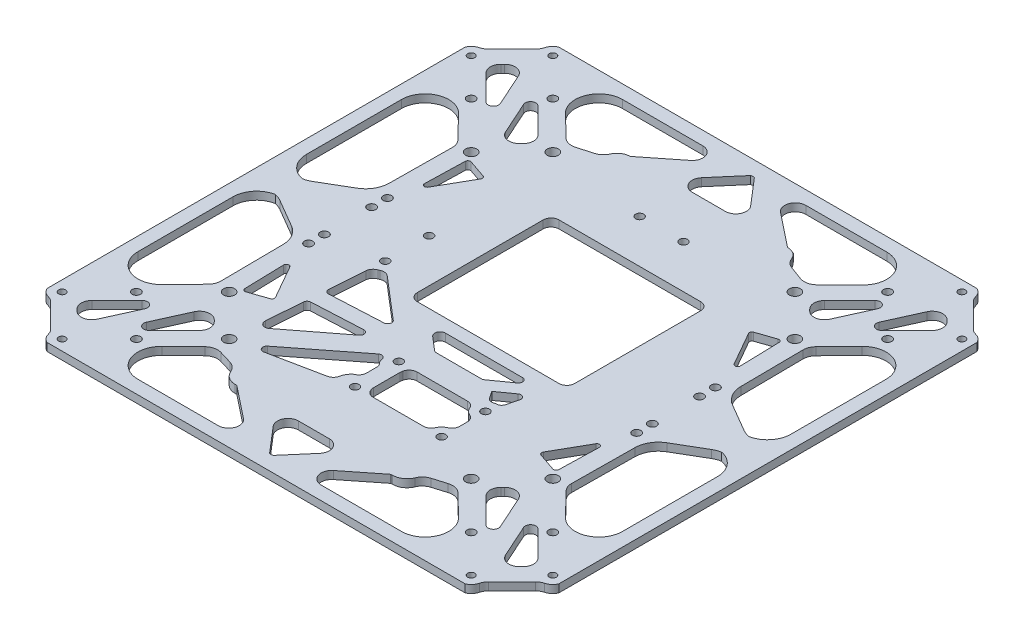
from build123d import *

# Parameters (mm, degrees)
SKETCH2_W                = 195
SKETCH2_H                = 195
BOSS_EXTRUDE1_DEPTH      = 3
CUT_EXTRUDE1_DEPTH       = 138.918454168
CUT_EXTRUDE1_DEPTH_BACK  = 138.918454168
SKETCH3_R                = 1.6
CUT_EXTRUDE2_DEPTH       = 138.918454168
CUT_EXTRUDE2_DEPTH_BACK  = 138.918454168
SKETCH4_R                = 2.11
SKETCH4_R_2              = 1.35
CUT_EXTRUDE3_DEPTH       = 138.918454168
CUT_EXTRUDE3_DEPTH_BACK  = 138.918454168
SKETCH5_R                = 2
CUT_EXTRUDE4_DEPTH       = 138.918454168
CUT_EXTRUDE4_DEPTH_BACK  = 138.918454168
SKETCH6_R                = 1.6
CUT_EXTRUDE5_DEPTH       = 138.918454168
CUT_EXTRUDE5_DEPTH_BACK  = 138.918454168
CUT_EXTRUDE7_DEPTH       = 138.918454168
CUT_EXTRUDE7_DEPTH_BACK  = 138.918454168
SKETCH8_R                = 3
SKETCH9_W                = 5.16198808
SKETCH9_H                = 152.468237428
BOSS_EXTRUDE2_DEPTH      = 3
FILLET1_R                = 9
BOSS_EXTRUDE3_DEPTH      = 3
FILLET2_R                = 9
FILLET3_R                = 4
BOSS_EXTRUDE4_DEPTH      = 3
SKETCH12_W               = 67.185291346
SKETCH12_H               = 7.329006054
SKETCH12_W_2             = 65.807604932
SKETCH12_H_2             = 7.680902366
BOSS_EXTRUDE5_DEPTH      = 3
CUT_EXTRUDE8_DEPTH       = 138.918454168
CUT_EXTRUDE8_DEPTH_BACK  = 138.918454168
SKETCH13_R               = 1.6
SKETCH14_W               = 7.084650063
SKETCH14_H               = 6.320619174
SKETCH14_W_2             = 7.244850247
SKETCH14_H_2             = 7.471829908
SKETCH14_H_3             = 7.337929735
SKETCH14_H_4             = 9.485616487
BOSS_EXTRUDE6_DEPTH      = 3
SKETCH15_W               = 76.15014778
SKETCH15_H               = 29.022259119
BOSS_EXTRUDE7_DEPTH      = 3
CUT_EXTRUDE9_DEPTH       = 138.918454168
CUT_EXTRUDE9_DEPTH_BACK  = 138.918454168
SKETCH16_W               = 60
SKETCH16_H               = 54
FILLET4_R                = 3
SKETCH17_R               = 1.55
CUT_EXTRUDE10_DEPTH      = 3
CUT_EXTRUDE11_DEPTH      = 138.918454168
CUT_EXTRUDE11_DEPTH_BACK = 138.918454168
SKETCH18_R               = 1.6
CUT_EXTRUDE12_DEPTH      = 138.918454168
CUT_EXTRUDE12_DEPTH_BACK = 138.918454168


with BuildPart() as part:
    # Sketch2 → Boss-Extrude1 (new body)
    with BuildSketch(Plane(origin=(0, 0, 0), x_dir=(1, 0, 0), z_dir=(0, 1, 0))):
        Rectangle(SKETCH2_W, SKETCH2_H)
    extrude(amount=BOSS_EXTRUDE1_DEPTH)

    # Sketch3 → Cut-Extrude1 (cut, two sides: drawn at the far end of the back side and taken through both)
    with BuildSketch(Plane(origin=(0, 3, 0), x_dir=(1, 0, 0), z_dir=(0, 1, 0)).offset(-CUT_EXTRUDE1_DEPTH_BACK)):
        with Locations(Location((47.5, 41.25, 0), (0, 0, 270))):
            Circle(SKETCH3_R)
        with Locations(Location((47.5, -41.25, 0), (0, 0, 90))):
            Circle(SKETCH3_R)
        with Locations(Location((-47.5, -41.25, 0), (0, 0, 270))):
            Circle(SKETCH3_R)
        with Locations(Location((-47.5, 41.25, 0), (0, 0, 90))):
            Circle(SKETCH3_R)
    extrude(amount=CUT_EXTRUDE1_DEPTH + CUT_EXTRUDE1_DEPTH_BACK, mode=Mode.SUBTRACT)

    # Sketch4 → Cut-Extrude2 (cut, two sides: drawn at the far end of the back side and taken through both)
    with BuildSketch(Plane(origin=(0, 3, 0), x_dir=(1, 0, 0), z_dir=(0, 1, 0)).offset(-CUT_EXTRUDE2_DEPTH_BACK)):
        with Locations(Location((46.123845661, 61.680194847, 0), (0, 0, 90))):
            Circle(SKETCH4_R)
        with Locations(Location((-61.680194847, 46.123845661, 0), (0, 0, 90))):
            Circle(SKETCH4_R)
        with Locations(Location((-77.943650814, 93.5, 0), (0, 0, 270))):
            Circle(SKETCH4_R_2)
        with Locations(Location((-93.5, 77.943650814, 0), (0, 0, 90))):
            Circle(SKETCH4_R_2)
        with Locations(Location((-46.123845661, 61.680194847, 0), (0, 0, 270))):
            Circle(SKETCH4_R)
        with Locations(Location((93.5, 77.943650814, 0), (0, 0, 270))):
            Circle(SKETCH4_R_2)
        with Locations(Location((77.943650814, 93.5, 0), (0, 0, 90))):
            Circle(SKETCH4_R_2)
        with Locations(Location((61.680194847, 46.123845661, 0), (0, 0, 270))):
            Circle(SKETCH4_R)
        with Locations(Location((61.680194847, -46.123845661, 0), (0, 0, 90))):
            Circle(SKETCH4_R)
        with Locations(Location((77.943650814, -93.5, 0), (0, 0, 270))):
            Circle(SKETCH4_R_2)
        with Locations(Location((93.5, -77.943650814, 0), (0, 0, 90))):
            Circle(SKETCH4_R_2)
        with Locations(Location((-46.123845661, -61.680194847, 0), (0, 0, 90))):
            Circle(SKETCH4_R)
        with Locations(Location((-93.5, -77.943650814, 0), (0, 0, 270))):
            Circle(SKETCH4_R_2)
        with Locations(Location((-77.943650814, -93.5, 0), (0, 0, 90))):
            Circle(SKETCH4_R_2)
        with Locations(Location((-61.680194847, -46.123845661, 0), (0, 0, 270))):
            Circle(SKETCH4_R)
        with Locations(Location((46.123845661, -61.680194847, 0), (0, 0, 270))):
            Circle(SKETCH4_R)
    extrude(amount=CUT_EXTRUDE2_DEPTH + CUT_EXTRUDE2_DEPTH_BACK, mode=Mode.SUBTRACT)

    # Sketch5 → Cut-Extrude3 (cut, two sides: drawn at the far end of the back side and taken through both)
    with BuildSketch(Plane(origin=(0, 3, 0), x_dir=(1, 0, 0), z_dir=(0, 1, 0)).offset(-CUT_EXTRUDE3_DEPTH_BACK)):
        with Locations(Location((30, 70, 0), (0, 0, 270))):
            Circle(SKETCH5_R)
        with Locations(Location((15, 70, 0), (0, 0, 270))):
            Circle(SKETCH5_R)
        with Locations(Location((-15, 70, 0), (0, 0, 90))):
            Circle(SKETCH5_R)
        with Locations(Location((-30, 70, 0), (0, 0, 90))):
            Circle(SKETCH5_R)
        with Locations(Location((-30, -70, 0), (0, 0, 270))):
            Circle(SKETCH5_R)
        with Locations(Location((-15, -70, 0), (0, 0, 270))):
            Circle(SKETCH5_R)
        with Locations(Location((15, -70, 0), (0, 0, 90))):
            Circle(SKETCH5_R)
        with Locations(Location((30, -70, 0), (0, 0, 90))):
            Circle(SKETCH5_R)
    extrude(amount=CUT_EXTRUDE3_DEPTH + CUT_EXTRUDE3_DEPTH_BACK, mode=Mode.SUBTRACT)

    # Sketch6 → Cut-Extrude4 (cut, two sides: drawn at the far end of the back side and taken through both)
    with BuildSketch(Plane(origin=(0, 3, 0), x_dir=(1, 0, 0), z_dir=(0, 1, 0)).offset(-CUT_EXTRUDE4_DEPTH_BACK)):
        with Locations(Location((-62.5, 15, 0), (0, 0, 270))):
            Circle(SKETCH6_R)
        with Locations(Location((-62.5, -15, 0), (0, 0, 90))):
            Circle(SKETCH6_R)
        with Locations(Location((62.5, -15, 0), (0, 0, 270))):
            Circle(SKETCH6_R)
        with Locations(Location((62.5, 15, 0), (0, 0, 90))):
            Circle(SKETCH6_R)
    extrude(amount=CUT_EXTRUDE4_DEPTH + CUT_EXTRUDE4_DEPTH_BACK, mode=Mode.SUBTRACT)

    # Sketch7 → Cut-Extrude5 (cut, two sides: drawn at the far end of the back side and taken through both)
    with BuildSketch(Plane(origin=(0, 3, 0), x_dir=(1, 0, 0), z_dir=(0, 1, 0)).offset(-CUT_EXTRUDE5_DEPTH_BACK)):
        with BuildLine():
            Line((-67.1, -15), (-67.099088544, 15.091567253))
            Line((-67.099088544, 15.091567253), (-66.810690491, 44.064798997))
            ThreePointArc((-66.810690491, 44.064798997), (-67.168435752, 45.972460378), (-68.225667159, 47.60016286))
            Line((-68.225667159, 47.60016286), (-92.33801192, 72.39859956))
            ThreePointArc((-92.33801192, 72.39859956), (-93.391805503, 73.22509409), (-94.627179243, 73.742226418))
            ThreePointArc((-94.627179243, 73.742226418), (-96.350328674, 74.657600533), (-97.5, 76.234118714))
            Line((-97.5, 76.234118714), (-97.5, -76.234118714))
            ThreePointArc((-97.5, -76.234118714), (-96.350328674, -74.657600533), (-94.627179243, -73.742226418))
            ThreePointArc((-94.627179243, -73.742226418), (-93.391805503, -73.22509409), (-92.33801192, -72.39859956))
            Line((-92.33801192, -72.39859956), (-68.225667159, -47.60016286))
            ThreePointArc((-68.225667159, -47.60016286), (-67.168435752, -45.972460378), (-66.810690491, -44.064798997))
            Line((-66.810690491, -44.064798997), (-67.099088544, -15.091567253))
            ThreePointArc((-67.099088544, -15.091567253), (-67.09977213, -15.045785894), (-67.1, -15))
        make_face()
        with BuildLine():
            ThreePointArc((-97.5, 79.653182914), (-96.342305944, 81.236642906), (-94.606672429, 82.150523302))
            ThreePointArc((-94.606672429, 82.150523302), (-93.388598506, 82.650187636), (-92.343175799, 83.450475015))
            Line((-92.343175799, 83.450475015), (-83.450475015, 92.343175799))
            ThreePointArc((-83.450475015, 92.343175799), (-82.650187636, 93.388598506), (-82.150523302, 94.606672429))
            ThreePointArc((-82.150523302, 94.606672429), (-81.236642906, 96.342305944), (-79.653182914, 97.5))
            Line((-79.653182914, 97.5), (-97.5, 97.5))
            Line((-97.5, 97.5), (-97.5, 79.653182914))
        make_face()
        with BuildLine():
            ThreePointArc((-94.606672429, -82.150523302), (-96.342305944, -81.236642906), (-97.5, -79.653182914))
            Line((-97.5, -79.653182914), (-97.5, -97.5))
            Line((-97.5, -97.5), (-79.653182914, -97.5))
            ThreePointArc((-79.653182914, -97.5), (-81.236642906, -96.342305944), (-82.150523302, -94.606672429))
            ThreePointArc((-82.150523302, -94.606672429), (-82.650187636, -93.388598506), (-83.450475015, -92.343175799))
            Line((-83.450475015, -92.343175799), (-92.343175799, -83.450475015))
            ThreePointArc((-92.343175799, -83.450475015), (-93.388598506, -82.650187636), (-94.606672429, -82.150523302))
        make_face()
        with BuildLine():
            Line((76.234118714, 97.5), (-76.234118714, 97.5))
            ThreePointArc((-76.234118714, 97.5), (-74.657600533, 96.350328674), (-73.742226418, 94.627179243))
            ThreePointArc((-73.742226418, 94.627179243), (-73.22509409, 93.391805503), (-72.39859956, 92.33801192))
            Line((-72.39859956, 92.33801192), (-48.235759925, 68.843679325))
            ThreePointArc((-48.235759925, 68.843679325), (-45.974176774, 67.580590379), (-43.384060973, 67.618697772))
            Line((-43.384060973, 67.618697772), (-37.791679223, 69.207086879))
            ThreePointArc((-37.791679223, 69.207086879), (-35.871810562, 70.248237651), (-34.578890795, 72.008422039))
            ThreePointArc((-34.578890795, 72.008422039), (-32.734765968, 74.185815942), (-30, 75))
            Line((-30, 75), (30, 75))
            ThreePointArc((30, 75), (32.793489967, 74.146855894), (34.633680134, 71.878565521))
            ThreePointArc((34.633680134, 71.878565521), (35.789643426, 70.16471047), (37.540094628, 69.064951015))
            Line((37.540094628, 69.064951015), (42.799329414, 67.128943555))
            ThreePointArc((42.799329414, 67.128943555), (45.584611872, 66.93434546), (48.039976467, 68.263575121))
            Line((48.039976467, 68.263575121), (72.419857752, 92.340779607))
            ThreePointArc((72.419857752, 92.340779607), (73.231780338, 93.389992898), (73.739189962, 94.615799689))
            ThreePointArc((73.739189962, 94.615799689), (74.653744886, 96.345877542), (76.234118714, 97.5))
        make_face()
        with BuildLine():
            ThreePointArc((-73.742226418, -94.627179243), (-74.657600533, -96.350328674), (-76.234118714, -97.5))
            Line((-76.234118714, -97.5), (76.234118714, -97.5))
            ThreePointArc((76.234118714, -97.5), (74.657600533, -96.350328674), (73.742226418, -94.627179243))
            ThreePointArc((73.742226418, -94.627179243), (73.22509409, -93.391805503), (72.39859956, -92.33801192))
            Line((72.39859956, -92.33801192), (48.235759925, -68.843679325))
            ThreePointArc((48.235759925, -68.843679325), (45.933721874, -67.570555303), (43.304064218, -67.642141429))
            Line((43.304064218, -67.642141429), (38.28462916, -69.158674052))
            ThreePointArc((38.28462916, -69.158674052), (36.361057884, -70.251030176), (35.097048147, -72.066422073))
            ThreePointArc((35.097048147, -72.066422073), (33.072838964, -74.561541483), (30, -75.5))
            Line((30, -75.5), (-30, -75.5))
            ThreePointArc((-30, -75.5), (-33.072838964, -74.561541483), (-35.097048147, -72.066422073))
            ThreePointArc((-35.097048147, -72.066422073), (-36.361057884, -70.251030176), (-38.28462916, -69.158674052))
            Line((-38.28462916, -69.158674052), (-43.304064218, -67.642141429))
            ThreePointArc((-43.304064218, -67.642141429), (-45.933721874, -67.570555303), (-48.235759925, -68.843679325))
            Line((-48.235759925, -68.843679325), (-72.39859956, -92.33801192))
            ThreePointArc((-72.39859956, -92.33801192), (-73.22509409, -93.391805503), (-73.742226418, -94.627179243))
        make_face()
        with BuildLine():
            Line((97.5, 97.5), (79.653182914, 97.5))
            ThreePointArc((79.653182914, 97.5), (81.236642906, 96.342305944), (82.150523302, 94.606672429))
            ThreePointArc((82.150523302, 94.606672429), (82.650187636, 93.388598506), (83.450475015, 92.343175799))
            Line((83.450475015, 92.343175799), (92.343175799, 83.450475015))
            ThreePointArc((92.343175799, 83.450475015), (93.388598506, 82.650187636), (94.606672429, 82.150523302))
            ThreePointArc((94.606672429, 82.150523302), (96.342305944, 81.236642906), (97.5, 79.653182914))
            Line((97.5, 79.653182914), (97.5, 97.5))
        make_face()
        with BuildLine():
            ThreePointArc((82.150523302, -94.606672429), (81.236642906, -96.342305944), (79.653182914, -97.5))
            Line((79.653182914, -97.5), (97.5, -97.5))
            Line((97.5, -97.5), (97.5, -79.653182914))
            ThreePointArc((97.5, -79.653182914), (96.342305944, -81.236642906), (94.606672429, -82.150523302))
            ThreePointArc((94.606672429, -82.150523302), (93.388598506, -82.650187636), (92.343175799, -83.450475015))
            Line((92.343175799, -83.450475015), (83.450475015, -92.343175799))
            ThreePointArc((83.450475015, -92.343175799), (82.650187636, -93.388598506), (82.150523302, -94.606672429))
        make_face()
        with BuildLine():
            ThreePointArc((94.627179243, -73.742226418), (96.350328674, -74.657600533), (97.5, -76.234118714))
            Line((97.5, -76.234118714), (97.5, 76.234118714))
            ThreePointArc((97.5, 76.234118714), (96.350328674, 74.657600533), (94.627179243, 73.742226418))
            ThreePointArc((94.627179243, 73.742226418), (93.391805503, 73.22509409), (92.33801192, 72.39859956))
            Line((92.33801192, 72.39859956), (68.225667159, 47.60016286))
            ThreePointArc((68.225667159, 47.60016286), (67.168435752, 45.972460378), (66.810690491, 44.064798997))
            Line((66.810690491, 44.064798997), (67.099088544, 15.091567253))
            ThreePointArc((67.099088544, 15.091567253), (67.09977213, 15.045785894), (67.1, 15))
            Line((67.1, 15), (67.099088544, -15.091567253))
            Line((67.099088544, -15.091567253), (66.810690491, -44.064798997))
            ThreePointArc((66.810690491, -44.064798997), (67.168435752, -45.972460378), (68.225667159, -47.60016286))
            Line((68.225667159, -47.60016286), (92.33801192, -72.39859956))
            ThreePointArc((92.33801192, -72.39859956), (93.391805503, -73.22509409), (94.627179243, -73.742226418))
        make_face()
    extrude(amount=CUT_EXTRUDE5_DEPTH + CUT_EXTRUDE5_DEPTH_BACK, mode=Mode.SUBTRACT)

    # Sketch8 → Cut-Extrude7 (cut, two sides: drawn at the far end of the back side and taken through both)
    with BuildSketch(Plane(origin=(0, 3, 0), x_dir=(1, 0, 0), z_dir=(0, 1, 0)).offset(-CUT_EXTRUDE7_DEPTH_BACK)):
        with Locations(Location((0, 0, 0), (0, 0, 270))):
            Circle(SKETCH8_R)
        with BuildLine():
            Line((-46.075946512, -21.34896745), (-46.075946512, 21.363521254))
            ThreePointArc((-46.075946512, 21.363521254), (-46.860319172, 22.339996984), (-47.982956213, 21.784630983))
            Line((-47.982956213, 21.784630983), (-56.124255266, 4.249445458))
            ThreePointArc((-56.124255266, 4.249445458), (-57.054155987, 0.045094312), (-56.129928738, -4.160507655))
            Line((-56.129928738, -4.160507655), (-47.98352356, -21.768853033))
            ThreePointArc((-47.98352356, -21.768853033), (-46.860977965, -22.325588422), (-46.075946512, -21.34896745))
        make_face()
        with BuildLine():
            Line((56.124255266, 4.249445458), (47.982956213, 21.784630983))
            ThreePointArc((47.982956213, 21.784630983), (46.860319172, 22.339996984), (46.075946512, 21.363521254))
            Line((46.075946512, 21.363521254), (46.075946512, -21.34896745))
            ThreePointArc((46.075946512, -21.34896745), (46.860977965, -22.325588422), (47.98352356, -21.768853033))
            Line((47.98352356, -21.768853033), (56.129928738, -4.160507655))
            ThreePointArc((56.129928738, -4.160507655), (57.054155987, 0.045094312), (56.124255266, 4.249445458))
        make_face()
        with BuildLine():
            Line((-58.318731361, 26.348348992), (-51.034926184, 39.095008052))
            ThreePointArc((-51.034926184, 39.095008052), (-50.967376772, 39.943698114), (-51.578125125, 40.536845815))
            Line((-51.578125125, 40.536845815), (-58.463843567, 42.903521965))
            ThreePointArc((-58.463843567, 42.903521965), (-59.359048857, 42.779356057), (-59.788541049, 41.984154106))
            Line((-59.788541049, 41.984154106), (-60.186627783, 26.870818896))
            ThreePointArc((-60.186627783, 26.870818896), (-59.456345727, 25.881451512), (-58.318731361, 26.348348992))
        make_face()
        with BuildLine():
            Line((-59.788541049, -41.984154106), (-60.186627783, -26.870818896))
            ThreePointArc((-60.186627783, -26.870818896), (-59.456345727, -25.881451512), (-58.318731361, -26.348348992))
            Line((-58.318731361, -26.348348992), (-51.034926184, -39.095008052))
            ThreePointArc((-51.034926184, -39.095008052), (-50.967376772, -39.943698114), (-51.578125125, -40.536845815))
            Line((-51.578125125, -40.536845815), (-58.463843567, -42.903521965))
            ThreePointArc((-58.463843567, -42.903521965), (-59.359048857, -42.779356057), (-59.788541049, -41.984154106))
        make_face()
        with BuildLine():
            Line((59.788541049, 41.984154106), (60.186627783, 26.870818896))
            ThreePointArc((60.186627783, 26.870818896), (59.456345727, 25.881451512), (58.318731361, 26.348348992))
            Line((58.318731361, 26.348348992), (51.034926184, 39.095008052))
            ThreePointArc((51.034926184, 39.095008052), (50.967376772, 39.943698114), (51.578125125, 40.536845815))
            Line((51.578125125, 40.536845815), (58.463843567, 42.903521965))
            ThreePointArc((58.463843567, 42.903521965), (59.359048857, 42.779356057), (59.788541049, 41.984154106))
        make_face()
        with BuildLine():
            Line((58.318731361, -26.348348992), (51.034926184, -39.095008052))
            ThreePointArc((51.034926184, -39.095008052), (50.967376772, -39.943698114), (51.578125125, -40.536845815))
            Line((51.578125125, -40.536845815), (58.463843567, -42.903521965))
            ThreePointArc((58.463843567, -42.903521965), (59.359048857, -42.779356057), (59.788541049, -41.984154106))
            Line((59.788541049, -41.984154106), (60.186627783, -26.870818896))
            ThreePointArc((60.186627783, -26.870818896), (59.456345727, -25.881451512), (58.318731361, -26.348348992))
        make_face()
        with BuildLine():
            Line((-29.190874416, -41.25), (-22, -41.25))
            ThreePointArc((-22, -41.25), (-17.050252532, -43.300252532), (-15, -48.25))
            Line((-15, -48.25), (-15, -58))
            ThreePointArc((-15, -58), (-17.050252532, -62.949747468), (-22, -65))
            Line((-22, -65), (-23.256091807, -65))
            ThreePointArc((-23.256091807, -65), (-26.685566957, -64.102352022), (-29.235481697, -61.639628628))
            Line((-29.235481697, -61.639628628), (-35.170264305, -51.889628628))
            ThreePointArc((-35.170264305, -51.889628628), (-35.293226438, -44.82052485), (-29.190874416, -41.25))
        make_face()
        with BuildLine():
            Line((29.190874416, 41.25), (22, 41.25))
            ThreePointArc((22, 41.25), (17.050252532, 43.300252532), (15, 48.25))
            Line((15, 48.25), (15, 58))
            ThreePointArc((15, 58), (17.050252532, 62.949747468), (22, 65))
            Line((22, 65), (23.256091807, 65))
            ThreePointArc((23.256091807, 65), (26.685566957, 64.102352022), (29.235481697, 61.639628628))
            Line((29.235481697, 61.639628628), (35.170264305, 51.889628628))
            ThreePointArc((35.170264305, 51.889628628), (35.293226438, 44.82052485), (29.190874416, 41.25))
        make_face()
        with BuildLine():
            Line((29.235481697, -61.639628628), (35.170264305, -51.889628628))
            ThreePointArc((35.170264305, -51.889628628), (35.293226438, -44.82052485), (29.190874416, -41.25))
            Line((29.190874416, -41.25), (22, -41.25))
            ThreePointArc((22, -41.25), (17.050252532, -43.300252532), (15, -48.25))
            Line((15, -48.25), (15, -58))
            ThreePointArc((15, -58), (17.050252532, -62.949747468), (22, -65))
            Line((22, -65), (23.256091807, -65))
            ThreePointArc((23.256091807, -65), (26.685566957, -64.102352022), (29.235481697, -61.639628628))
        make_face()
        with BuildLine():
            Line((-29.235481697, 61.639628628), (-35.170264305, 51.889628628))
            ThreePointArc((-35.170264305, 51.889628628), (-35.293226438, 44.82052485), (-29.190874416, 41.25))
            Line((-29.190874416, 41.25), (-22, 41.25))
            ThreePointArc((-22, 41.25), (-17.050252532, 43.300252532), (-15, 48.25))
            Line((-15, 48.25), (-15, 58))
            ThreePointArc((-15, 58), (-17.050252532, 62.949747468), (-22, 65))
            Line((-22, 65), (-23.256091807, 65))
            ThreePointArc((-23.256091807, 65), (-26.685566957, 64.102352022), (-29.235481697, 61.639628628))
        make_face()
        with BuildLine():
            Line((-55.317751874, 58.143142882), (-54.609127035, 58.851767722))
            ThreePointArc((-54.609127035, 58.851767722), (-53.437554159, 61.680194847), (-54.609127035, 64.508621971))
            Line((-54.609127035, 64.508621971), (-64.215657306, 74.115152242))
            ThreePointArc((-64.215657306, 74.115152242), (-66.766627573, 74.346473303), (-67.453044382, 71.878723174))
            Line((-67.453044382, 71.878723174), (-61.792526027, 59.327138995))
            ThreePointArc((-61.792526027, 59.327138995), (-58.865699631, 57.036815878), (-55.317751874, 58.143142882))
        make_face()
        with BuildLine():
            Line((-84.306093786, 81.480702778), (-85.014718626, 80.772077939))
            ThreePointArc((-85.014718626, 80.772077939), (-86.186291501, 77.943650814), (-85.014718626, 75.115223689))
            Line((-85.014718626, 75.115223689), (-75.408188355, 65.508693418))
            ThreePointArc((-75.408188355, 65.508693418), (-72.857218088, 65.277372358), (-72.170801279, 67.745122487))
            Line((-72.170801279, 67.745122487), (-77.831319634, 80.296706666))
            ThreePointArc((-77.831319634, 80.296706666), (-80.758146029, 82.587029783), (-84.306093786, 81.480702778))
        make_face()
        with BuildLine():
            Line((55.317751874, -58.143142882), (54.609127035, -58.851767722))
            ThreePointArc((54.609127035, -58.851767722), (53.437554159, -61.680194847), (54.609127035, -64.508621971))
            Line((54.609127035, -64.508621971), (64.215657306, -74.115152242))
            ThreePointArc((64.215657306, -74.115152242), (66.766627573, -74.346473303), (67.453044382, -71.878723174))
            Line((67.453044382, -71.878723174), (61.792526027, -59.327138995))
            ThreePointArc((61.792526027, -59.327138995), (58.865699631, -57.036815878), (55.317751874, -58.143142882))
        make_face()
        with BuildLine():
            Line((-32.5, -18.207707646), (-14.5051535, -3.060146984))
            ThreePointArc((-14.5051535, -3.060146984), (-13.081100012, 0), (-14.5051535, 3.060146984))
            Line((-14.5051535, 3.060146984), (-32.5, 18.207707646))
            ThreePointArc((-32.5, 18.207707646), (-36.763580055, 18.774114539), (-39.075946512, 15.147560662))
            Line((-39.075946512, 15.147560662), (-39.075946512, -15.147560662))
            ThreePointArc((-39.075946512, -15.147560662), (-36.763580055, -18.774114539), (-32.5, -18.207707646))
        make_face()
        with BuildLine():
            Line((67.453044382, 71.878723174), (61.792526027, 59.327138995))
            ThreePointArc((61.792526027, 59.327138995), (58.865699631, 57.036815878), (55.317751874, 58.143142882))
            Line((55.317751874, 58.143142882), (54.609127035, 58.851767722))
            ThreePointArc((54.609127035, 58.851767722), (53.437554159, 61.680194847), (54.609127035, 64.508621971))
            Line((54.609127035, 64.508621971), (64.215657306, 74.115152242))
            ThreePointArc((64.215657306, 74.115152242), (66.766627573, 74.346473303), (67.453044382, 71.878723174))
        make_face()
        with BuildLine():
            Line((77.831319634, 80.296706666), (72.170801279, 67.745122487))
            ThreePointArc((72.170801279, 67.745122487), (72.857218088, 65.277372358), (75.408188355, 65.508693418))
            Line((75.408188355, 65.508693418), (85.014718626, 75.115223689))
            ThreePointArc((85.014718626, 75.115223689), (86.186291501, 77.943650814), (85.014718626, 80.772077939))
            Line((85.014718626, 80.772077939), (84.306093786, 81.480702778))
            ThreePointArc((84.306093786, 81.480702778), (80.758146029, 82.587029783), (77.831319634, 80.296706666))
        make_face()
        with BuildLine():
            Line((84.306093786, -81.480702778), (85.014718626, -80.772077939))
            ThreePointArc((85.014718626, -80.772077939), (86.186291501, -77.943650814), (85.014718626, -75.115223689))
            Line((85.014718626, -75.115223689), (75.408188355, -65.508693418))
            ThreePointArc((75.408188355, -65.508693418), (72.857218088, -65.277372358), (72.170801279, -67.745122487))
            Line((72.170801279, -67.745122487), (77.831319634, -80.296706666))
            ThreePointArc((77.831319634, -80.296706666), (80.758146029, -82.587029783), (84.306093786, -81.480702778))
        make_face()
        with BuildLine():
            Line((-67.453044382, -71.878723174), (-61.792526027, -59.327138995))
            ThreePointArc((-61.792526027, -59.327138995), (-58.865699631, -57.036815878), (-55.317751874, -58.143142882))
            Line((-55.317751874, -58.143142882), (-54.609127035, -58.851767722))
            ThreePointArc((-54.609127035, -58.851767722), (-53.437554159, -61.680194847), (-54.609127035, -64.508621971))
            Line((-54.609127035, -64.508621971), (-64.215657306, -74.115152242))
            ThreePointArc((-64.215657306, -74.115152242), (-66.766627573, -74.346473303), (-67.453044382, -71.878723174))
        make_face()
        with BuildLine():
            Line((-77.831319634, -80.296706666), (-72.170801279, -67.745122487))
            ThreePointArc((-72.170801279, -67.745122487), (-72.857218088, -65.277372358), (-75.408188355, -65.508693418))
            Line((-75.408188355, -65.508693418), (-85.014718626, -75.115223689))
            ThreePointArc((-85.014718626, -75.115223689), (-86.186291501, -77.943650814), (-85.014718626, -80.772077939))
            Line((-85.014718626, -80.772077939), (-84.306093786, -81.480702778))
            ThreePointArc((-84.306093786, -81.480702778), (-80.758146029, -82.587029783), (-77.831319634, -80.296706666))
        make_face()
        with BuildLine():
            Line((-20.31441961, 26.25), (-2.575946512, 11.318247329))
            ThreePointArc((-2.575946512, 11.318247329), (0, 10.378394314), (2.575946512, 11.318247329))
            Line((2.575946512, 11.318247329), (20.31441961, 26.25))
            ThreePointArc((20.31441961, 26.25), (21.496171059, 30.681170701), (17.738473098, 33.310146984))
            Line((17.738473098, 33.310146984), (-17.738473098, 33.310146984))
            ThreePointArc((-17.738473098, 33.310146984), (-21.496171059, 30.681170701), (-20.31441961, 26.25))
        make_face()
        with BuildLine():
            Line((32.5, -18.207707646), (14.5051535, -3.060146984))
            ThreePointArc((14.5051535, -3.060146984), (13.081100012, 0), (14.5051535, 3.060146984))
            Line((14.5051535, 3.060146984), (32.5, 18.207707646))
            ThreePointArc((32.5, 18.207707646), (36.763580055, 18.774114539), (39.075946512, 15.147560662))
            Line((39.075946512, 15.147560662), (39.075946512, -15.147560662))
            ThreePointArc((39.075946512, -15.147560662), (36.763580055, -18.774114539), (32.5, -18.207707646))
        make_face()
        with BuildLine():
            Line((17.738473098, -33.310146984), (-17.738473098, -33.310146984))
            ThreePointArc((-17.738473098, -33.310146984), (-21.496171059, -30.681170701), (-20.31441961, -26.25))
            Line((-20.31441961, -26.25), (-2.575946512, -11.318247329))
            ThreePointArc((-2.575946512, -11.318247329), (0, -10.378394314), (2.575946512, -11.318247329))
            Line((2.575946512, -11.318247329), (20.31441961, -26.25))
            ThreePointArc((20.31441961, -26.25), (21.496171059, -30.681170701), (17.738473098, -33.310146984))
        make_face()
    extrude(amount=CUT_EXTRUDE7_DEPTH + CUT_EXTRUDE7_DEPTH_BACK, mode=Mode.SUBTRACT)

    # Sketch9 → Boss-Extrude2 (add)
    with BuildSketch(Plane(origin=(0, 0, 0), x_dir=(1, 0, 0), z_dir=(0, 1, 0))):
        Polygon((-76.234118714, 97.5), (76.234118714, 97.5), (75.78009356, 92.33801192), (-72.39859956, 92.33801192), (-74.953859457, 93.391805503), align=None)
        with Locations((-94.91900596, 0)):
            Rectangle(SKETCH9_W, SKETCH9_H)
        with Locations((94.91900596, 0)):
            Rectangle(SKETCH9_W, SKETCH9_H)
        Polygon((-74.953859457, -93.391805503), (-72.39859956, -92.33801192), (72.39859956, -92.33801192), (75.78009356, -93.391805503), (76.234118714, -97.5), (-76.234118714, -97.5), align=None)
    extrude(amount=BOSS_EXTRUDE2_DEPTH)

    # Fillet1
    fillet1_edges = [part.edges().sort_by_distance(p)[0] for p in [
        (72.417055273, 1.5, -92.33801192),
        (92.33801192, 1.5, -72.39859956),
        (-72.39859956, 1.5, -92.33801192),
        (-92.33801192, 1.5, -72.39859956),
        (-92.33801192, 1.5, 72.39859956),
        (-72.39859956, 1.5, 92.33801192),
        (72.39859956, 1.5, 92.33801192),
        (92.33801192, 1.5, 72.39859956),
    ]]
    fillet(fillet1_edges, radius=FILLET1_R)

    # Sketch10 → Boss-Extrude3 (add)
    with BuildSketch(Plane.XZ):
        Polygon((15, -75), (0.131749864, -92.33801192), (8.131749864, -92.33801192), (30, -75), align=None)
        Polygon((-30, -75), (-8.131749864, -92.33801192), (-0.131749864, -92.33801192), (-15, -75), align=None)
        Polygon((-15, 75), (-0.131749864, 92.33801192), (-8.131749864, 92.33801192), (-30, 75), align=None)
        Polygon((30, 75), (8.131749864, 92.33801192), (0.131749864, 92.33801192), (15, 75), align=None)
        Polygon((-92.33801192, 5), (-92.33801192, -5), (-84.33801192, -5), (-67.099088544, -15.091567253), (-67.099088544, 15.091567253), (-84.33801192, 5), align=None)
        Polygon((92.33801192, -5), (92.33801192, 5), (84.33801192, 5), (67.099088544, 15.091567253), (67.099088544, -15.091567253), (84.33801192, -5), align=None)
    extrude(amount=-BOSS_EXTRUDE3_DEPTH)

    # Fillet2
    # the kernel refuses this fillet: 9 mm, written as the material it adds along each edge
    with BuildSketch(Plane(origin=(84.33801192, 0, 5), x_dir=(-0.8630037712429959, 0, 0.5051974770526539), z_dir=(0, 1, 0)), Plane(origin=(-84.33801192, 0, -5), x_dir=(0.8630037712431919, 0, -0.5051974770523192), z_dir=(0, 1, 0))) as fillet2_piece_1:
        with BuildLine():
            CenterArc((FILLET2_R * 0.271173620178, FILLET2_R), FILLET2_R, 239.655537794, 30.344462206)
            Line((-FILLET2_R * 0.234023856875, FILLET2_R * 0.136996228757), (0, 0))
            Line((0, 0), (FILLET2_R * 0.271173620178, 0))
        make_face()
    extrude(amount=3)
    with BuildSketch(Plane(origin=(92.33801192, 0, 5), x_dir=(0, 0, 1), z_dir=(0, 1, 0)), Plane(origin=(-92.33801192, 0, -5), x_dir=(0, 0, -1), z_dir=(0, 1, 0))) as fillet2_piece_2:
        with BuildLine():
            CenterArc((FILLET2_R, -FILLET2_R), FILLET2_R, 90, 90)
            Line((0, -FILLET2_R), (0, 0))
            Line((0, 0), (FILLET2_R, 0))
        make_face()
    extrude(amount=3)
    with BuildSketch(Plane(origin=(67.099088544, 0, 15.091567253), x_dir=(-0.009953455302394536, 0, 0.9999504631368212), z_dir=(0, 1, 0)), Plane(origin=(67.099088544, 3, -15.091567253), x_dir=(-0.00995345530239279, 0, -0.9999504631368212), z_dir=(0, -1, 0)), Plane(origin=(-67.099088544, 0, -15.091567253), x_dir=(0.009953455302046058, 0, -0.9999504631368247), z_dir=(0, 1, 0))) as fillet2_piece_3:
        with BuildLine():
            CenterArc((FILLET2_R * 0.566755129621, FILLET2_R), FILLET2_R, 210.914762604, 59.085237396)
            Line((-FILLET2_R * 0.291177430616, FILLET2_R * 0.486237679383), (0, 0))
            Line((0, 0), (FILLET2_R * 0.566755129621, 0))
        make_face()
    extrude(amount=3)
    with BuildSketch(Plane(origin=(84.33801192, 0, -5), x_dir=(-0.8630037712431919, 0, -0.5051974770523192), z_dir=(0, 1, 0)), Plane(origin=(-84.33801192, 0, 5), x_dir=(0.8630037712429962, 0, 0.5051974770526534), z_dir=(0, 1, 0))) as fillet2_piece_4:
        with BuildLine():
            CenterArc((FILLET2_R * 0.271173620177, -FILLET2_R), FILLET2_R, 90, 30.344462206)
            Line((-FILLET2_R * 0.234023856875, -FILLET2_R * 0.136996228757), (0, 0))
            Line((0, 0), (FILLET2_R * 0.271173620177, 0))
        make_face()
    extrude(amount=3)
    with BuildSketch(Plane(origin=(92.33801192, 0, -5), x_dir=(0, 0, -1), z_dir=(0, 1, 0)), Plane(origin=(-92.33801192, 0, 5), x_dir=(0, 0, 1), z_dir=(0, 1, 0))) as fillet2_piece_5:
        with BuildLine():
            CenterArc((FILLET2_R, FILLET2_R), FILLET2_R, 180, 90)
            Line((0, FILLET2_R), (0, 0))
            Line((0, 0), (FILLET2_R, 0))
        make_face()
    extrude(amount=3)
    with BuildSketch(Plane(origin=(-67.099088544, 0, 15.091567253), x_dir=(0.009953455302383283, 0, 0.9999504631368213), z_dir=(0, 1, 0))) as fillet2_piece_6:
        with BuildLine():
            CenterArc((FILLET2_R * 0.566755129621, -FILLET2_R), FILLET2_R, 90, 59.085237396)
            Line((-FILLET2_R * 0.291177430616, -FILLET2_R * 0.486237679383), (0, 0))
            Line((0, 0), (FILLET2_R * 0.566755129621, 0))
        make_face()
    extrude(amount=3)

    # Fillet3
    fillet3_edges = [part.edges().sort_by_distance(p)[0] for p in [
        (-14.571223904, 1.5, 75.5),
        (-8.131749864, 1.5, 92.33801192),
        (8.131749864, 1.5, 92.33801192),
        (14.571223904, 1.5, 75.5),
        (15, 1.5, -75),
        (8.131749864, 1.5, -92.33801192),
        (-8.131749864, 1.5, -92.33801192),
        (-15, 1.5, -75),
    ]]
    fillet(fillet3_edges, radius=FILLET3_R)

    # Sketch11 → Boss-Extrude4 (add)
    with BuildSketch(Plane.XZ):
        with BuildLine():
            Line((-1.502465546, 92.33801192), (1.497534454, 92.33801192))
            Line((1.497534454, 92.33801192), (1.497534454, 90.83801192))
            ThreePointArc((1.497534454, 90.83801192), (-0.002465546, 91.809351713), (-1.502465546, 90.83801192))
            Line((-1.502465546, 90.83801192), (-1.502465546, 92.33801192))
        make_face()
        with BuildLine():
            Line((-1.502465546, -92.33801192), (-1.502465546, -90.83801192))
            ThreePointArc((-1.502465546, -90.83801192), (-0.002465546, -91.809351713), (1.497534454, -90.83801192))
            Line((1.497534454, -90.83801192), (1.497534454, -92.33801192))
            Line((1.497534454, -92.33801192), (-1.502465546, -92.33801192))
        make_face()
    extrude(amount=-BOSS_EXTRUDE4_DEPTH)

    # Sketch12 → Boss-Extrude5 (add)
    with BuildSketch(Plane(origin=(0, 0, 0), x_dir=(1, 0, 0), z_dir=(0, 1, 0))):
        with Locations((-0.519806709, -68.837538491)):
            Rectangle(SKETCH12_W, SKETCH12_H)
        with Locations((0.169036498, 70.345364759)):
            Rectangle(SKETCH12_W_2, SKETCH12_H_2)
    extrude(amount=BOSS_EXTRUDE5_DEPTH)

    # Sketch13 → Cut-Extrude8 (cut, two sides: drawn at the far end of the back side and taken through both)
    with BuildSketch(Plane(origin=(0, 3, 0), x_dir=(1, 0, 0), z_dir=(0, 1, 0)).offset(-CUT_EXTRUDE8_DEPTH_BACK)):
        with Locations(Location((-62.5, 9, 0), (0, 0, 270))):
            Circle(SKETCH13_R)
        with Locations(Location((-62.5, -9, 0), (0, 0, 90))):
            Circle(SKETCH13_R)
        with Locations(Location((62.5, -9, 0), (0, 0, 270))):
            Circle(SKETCH13_R)
        with Locations(Location((62.5, 9, 0), (0, 0, 90))):
            Circle(SKETCH13_R)
    extrude(amount=CUT_EXTRUDE8_DEPTH + CUT_EXTRUDE8_DEPTH_BACK, mode=Mode.SUBTRACT)

    # Sketch14 → Boss-Extrude6 (add)
    with BuildSketch(Plane(origin=(0, 3, 0), x_dir=(1, 0, 0), z_dir=(0, 1, 0))):
        with Locations((-46.210776171, -41.637759037)):
            Rectangle(SKETCH14_W, SKETCH14_H)
        with Locations((46.847651561, -41.06215367)):
            Rectangle(SKETCH14_W_2, SKETCH14_H_2)
        with Locations((-46.210776171, 41.649000738)):
            Rectangle(SKETCH14_W, SKETCH14_H_3)
        with Locations((46.847651561, 40.575157362)):
            Rectangle(SKETCH14_W_2, SKETCH14_H_4)
    extrude(amount=-BOSS_EXTRUDE6_DEPTH)

    # Sketch15 → Boss-Extrude7 (add)
    with BuildSketch(Plane(origin=(0, 0, 0), x_dir=(1, 0, 0), z_dir=(0, 1, 0))):
        with Locations((0.036097087, -52.660909868)):
            Rectangle(SKETCH15_W, SKETCH15_H)
        Polygon((58.562577352, -23.055568165), (26.305881429, -23.055568165), (26.305881429, -35.895612173), (-27.246497238, -35.895612173), (-27.246497238, -23.055568165), (-57.937334136, -23.055568165), (-57.937334136, 24.546546207), (-27.246497238, 24.546546207), (-27.246497238, 38.012933825), (-41.652400272, 38.012933825), (-41.652400272, 66.511568087), (40.085440852, 66.511568087), (40.085440852, 38.012933825), (26.305881429, 38.012933825), (26.305881429, 24.546546207), (58.562577352, 24.546546207), align=None)
    extrude(amount=BOSS_EXTRUDE7_DEPTH)

    # Sketch16 → Cut-Extrude9 (cut, two sides: drawn at the far end of the back side and taken through both)
    with BuildSketch(Plane(origin=(0, 3, 0), x_dir=(1, 0, 0), z_dir=(0, 1, 0)).offset(-CUT_EXTRUDE9_DEPTH_BACK)):
        with Locations((4.4, 13.5)):
            Rectangle(SKETCH16_W, SKETCH16_H)
    extrude(amount=CUT_EXTRUDE9_DEPTH + CUT_EXTRUDE9_DEPTH_BACK, mode=Mode.SUBTRACT)

    # Fillet4
    fillet4_edges = [part.edges().sort_by_distance(p)[0] for p in [
        (34.4, 1.5, -40.5),
        (34.4, 1.5, 13.5),
        (-25.6, 1.5, 13.5),
        (-25.6, 1.5, -40.5),
    ]]
    fillet(fillet4_edges, radius=FILLET4_R)

    # Sketch17 → Cut-Extrude10 (cut)
    with BuildSketch(Plane(origin=(0, 3, 0), x_dir=(1, 0, 0), z_dir=(0, 1, 0))):
        with Locations(Location((-42.1, 10.5, 0), (0, 0, 270))):
            Circle(SKETCH17_R)
        with Locations(Location((-42.1, -6.21, 0), (0, 0, 270))):
            Circle(SKETCH17_R)
        with Locations(Location((-6.376154339, -36.746034728, 0), (0, 0, 270))):
            Circle(SKETCH17_R)
        with Locations(Location((-6.376154339, -53.456034728, 0), (0, 0, 270))):
            Circle(SKETCH17_R)
        with Locations(Location((26.623845661, -36.746034728, 0), (0, 0, 270))):
            Circle(SKETCH17_R)
        with Locations(Location((26.623845661, -53.456034728, 0), (0, 0, 270))):
            Circle(SKETCH17_R)
        with Locations(Location((8.354999866, 57.002112452, 0), (0, 0, 270))):
            Circle(SKETCH17_R)
        with Locations(Location((-8.355, 57, 0), (0, 0, 270))):
            Circle(SKETCH17_R)
    extrude(amount=-CUT_EXTRUDE10_DEPTH, mode=Mode.SUBTRACT)

    # Sketch18 → Cut-Extrude11 (cut, two sides: drawn at the far end of the back side and taken through both)
    with BuildSketch(Plane(origin=(0, 3, 0), x_dir=(1, 0, 0), z_dir=(0, 1, 0)).offset(-CUT_EXTRUDE11_DEPTH_BACK)):
        with Locations(Location((-63.80151519, 79.357864376, 0), (0, 0, 270))):
            Circle(SKETCH18_R)
        with Locations(Location((-79.357864376, 63.80151519, 0), (0, 0, 90))):
            Circle(SKETCH18_R)
        with Locations(Location((79.357864376, 63.80151519, 0), (0, 0, 270))):
            Circle(SKETCH18_R)
        with Locations(Location((63.80151519, 79.357864376, 0), (0, 0, 90))):
            Circle(SKETCH18_R)
        with Locations(Location((63.80151519, -79.357864376, 0), (0, 0, 270))):
            Circle(SKETCH18_R)
        with Locations(Location((79.357864376, -63.80151519, 0), (0, 0, 90))):
            Circle(SKETCH18_R)
        with Locations(Location((-79.357864376, -63.80151519, 0), (0, 0, 270))):
            Circle(SKETCH18_R)
        with Locations(Location((-63.80151519, -79.357864376, 0), (0, 0, 90))):
            Circle(SKETCH18_R)
    extrude(amount=CUT_EXTRUDE11_DEPTH + CUT_EXTRUDE11_DEPTH_BACK, mode=Mode.SUBTRACT)

    # Sketch20 → Cut-Extrude12 (cut, two sides: drawn at the far end of the back side and taken through both)
    with BuildSketch(Plane(origin=(0, 3, 0), x_dir=(1, 0, 0), z_dir=(0, 1, 0)).offset(-CUT_EXTRUDE12_DEPTH_BACK)):
        with BuildLine():
            ThreePointArc((22.47806898, -18.5), (23.90692636, -19.543528109), (23.347713288, -21.222177883))
            Line((23.347713288, -21.222177883), (15.584613359, -26.746034728))
            Line((15.584613359, -26.746034728), (0.55222931, -26.746034728))
            Line((0.55222931, -26.746034728), (-1.946364371, -26.746034728))
            ThreePointArc((-1.946364371, -26.746034728), (-2.638977793, -26.622277422), (-3.245875244, -26.266321375))
            Line((-3.245875244, -26.266321375), (-5.14516455, -24.642846547))
            Line((-5.14516455, -24.642846547), (-8.213274929, -22.020286648))
            ThreePointArc((-8.213274929, -22.020286648), (-8.79000675, -19.807386578), (-6.913764056, -18.5))
            Line((-6.913764056, -18.5), (22.47806898, -18.5))
        make_face()
        with BuildLine():
            ThreePointArc((-2.18241673, -51.689611249), (-2.21362049, -51.621648334), (-2.245726487, -51.554106957))
            ThreePointArc((-2.245726487, -51.554106957), (-2.469150497, -50.918040577), (-2.544900285, -50.248144543))
            Line((-2.544900285, -50.248144543), (-2.544900285, -40.193148575))
            ThreePointArc((-2.544900285, -40.193148575), (-2.522155863, -39.824435644), (-2.454267468, -39.461313489))
            ThreePointArc((-2.454267468, -39.461313489), (-2.42432336, -39.333524843), (-2.398549849, -39.20483019))
            ThreePointArc((-2.398549849, -39.20483019), (-1.36823761, -37.441298993), (0.55222931, -36.746034728))
            Line((0.55222931, -36.746034728), (19.695462011, -36.746034728))
            ThreePointArc((19.695462011, -36.746034728), (21.34225299, -37.238430399), (22.448462136, -38.553981748))
            ThreePointArc((22.448462136, -38.553981748), (23.406509806, -39.963370582), (24.815898641, -40.921418252))
            ThreePointArc((24.815898641, -40.921418252), (26.131449989, -42.027627398), (26.623845661, -43.674418378))
            Line((26.623845661, -43.674418378), (26.623845661, -46.527651078))
            ThreePointArc((26.623845661, -46.527651078), (26.131449989, -48.174442057), (24.815898641, -49.280651204))
            ThreePointArc((24.815898641, -49.280651204), (23.406509806, -50.238698873), (22.448462136, -51.648087708))
            ThreePointArc((22.448462136, -51.648087708), (21.34225299, -52.963639057), (19.695462011, -53.456034728))
            Line((19.695462011, -53.456034728), (0.55222931, -53.456034728))
            ThreePointArc((0.55222931, -53.456034728), (-1.075540703, -52.97602774), (-2.18241673, -51.689611249))
        make_face()
        with BuildLine():
            Line((21.185792417, -28.897085365), (23.07173769, -31.619142007))
            ThreePointArc((23.07173769, -31.619142007), (24.058846992, -32.369186673), (25.298349398, -32.393384999))
            ThreePointArc((25.298349398, -32.393384999), (25.831914193, -32.265482915), (26.376995047, -32.202735841))
            ThreePointArc((26.376995047, -32.202735841), (27.533104301, -31.755116397), (28.203300481, -30.71214523))
            Line((28.203300481, -30.71214523), (29.346879546, -26.343403803))
            ThreePointArc((29.346879546, -26.343403803), (28.7479136, -24.729111414), (27.026126839, -24.741378037))
            Line((27.026126839, -24.741378037), (21.185792417, -28.897085365))
        make_face()
        with BuildLine():
            ThreePointArc((-12.758368613, -38.172321464), (-11.286659447, -37.958233637), (-10.353955874, -39.11660556))
            ThreePointArc((-10.353955874, -39.11660556), (-9.937831989, -40.36163732), (-9.144185854, -41.407289741))
            ThreePointArc((-9.144185854, -41.407289741), (-8.824850818, -42.150635277), (-8.715761243, -42.952281656))
            Line((-8.715761243, -42.952281656), (-8.715761243, -46.692915256))
            ThreePointArc((-8.715761243, -46.692915256), (-9.251897049, -48.404456443), (-10.668676733, -49.504251954))
            ThreePointArc((-10.668676733, -49.504251954), (-11.989109973, -50.905987269), (-12.758368613, -52.671390051))
            ThreePointArc((-12.758368613, -52.671390051), (-13.529128179, -54.352887616), (-15.139653501, -55.262674711))
            Line((-15.139653501, -55.262674711), (-35.263821397, -59.359186552))
            ThreePointArc((-35.263821397, -59.359186552), (-36.925238113, -58.517330308), (-36.486412703, -56.707230946))
            Line((-36.486412703, -56.707230946), (-12.758368613, -38.172321464))
        make_face()
        with BuildLine():
            Line((-23.594859048, -32.950311344), (-42.790690579, -33.921202103))
            ThreePointArc((-42.790690579, -33.921202103), (-43.763914131, -34.347087753), (-44.210989017, -35.310761304))
            Line((-44.210989017, -35.310761304), (-45.191419201, -48.826352586))
            ThreePointArc((-45.191419201, -48.826352586), (-44.144054264, -50.732429718), (-41.976371931, -50.555634233))
            Line((-41.976371931, -50.555634233), (-22.603872033, -35.636831781))
            ThreePointArc((-22.603872033, -35.636831781), (-22.111780716, -33.929277391), (-23.594859048, -32.950311344))
        make_face()
        with BuildLine():
            Line((-43.554881118, -26.266072197), (-42.601272507, -13.120226181))
            ThreePointArc((-42.601272507, -13.120226181), (-41.991021009, -11.513376115), (-40.598882511, -10.505246941))
            ThreePointArc((-40.598882511, -10.505246941), (-40.346771583, -10.40865337), (-40.100833495, -10.297277001))
            ThreePointArc((-40.100833495, -10.297277001), (-38.405169357, -10.016034833), (-36.833435424, -10.711754943))
            Line((-36.833435424, -10.711754943), (-21.030154052, -24.220086419))
            ThreePointArc((-21.030154052, -24.220086419), (-20.584930272, -25.844043365), (-21.929016749, -26.858386462))
            Line((-21.929016749, -26.858386462), (-41.983041765, -27.872683109))
            ThreePointArc((-41.983041765, -27.872683109), (-43.13101163, -27.423592062), (-43.554881118, -26.266072197))
        make_face()
    extrude(amount=CUT_EXTRUDE12_DEPTH + CUT_EXTRUDE12_DEPTH_BACK, mode=Mode.SUBTRACT)


solid = part.part
